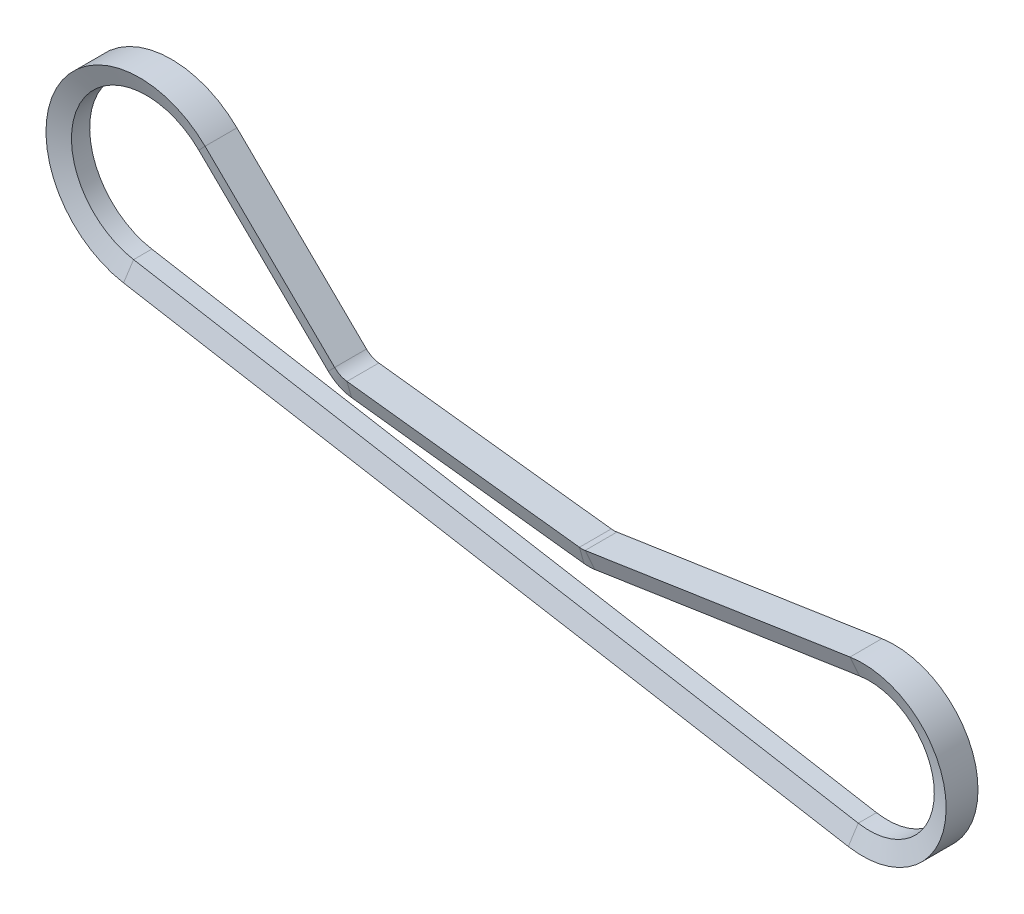
from build123d import *


with BuildPart() as part:
    # Sweep1: sweep along a path in Sketch2
    with BuildLine(Plane.XY) as sweep1_path:
        Line((-4.272916161, -24.63213729), (-221.015569811, 12.966028741))
        ThreePointArc((-221.015569811, 12.966028741), (-241.153300633, 53.314284487), (-196.645654553, 60.565448865))
        Line((-196.645654553, 60.565448865), (-157.89913651, 22.646039738))
        ThreePointArc((-157.89913651, 22.646039738), (-156.197292141, 21.455717085), (-154.202405086, 20.8781637))
        Line((-154.202405086, 20.8781637), (-84.685441924, 12.668910828))
        ThreePointArc((-84.685441924, 12.668910828), (-83.835963213, 12.625957058), (-82.988364486, 12.696918343))
        Line((-82.988364486, 12.696918343), (-3.749531212, 24.717221035))
        ThreePointArc((-3.749531212, 24.717221035), (24.998594105, -0.265127822), (-4.272916161, -24.63213729))
    # Sketch3 → Sweep1 (sweep)
    with BuildSketch(Plane(origin=(-3.749531212, 24.717221035, 0), x_dir=(0.14998124846515515, -0.9886888413999794, 0), z_dir=(0.9886888413999793, 0.14998124846515512, 0))):
        Polygon((0, -4.7625), (0, 4.7625), (5.588, 2.728634331), (5.588, -2.728634331), align=None)
    sweep(path=sweep1_path.line)


solid = part.part
